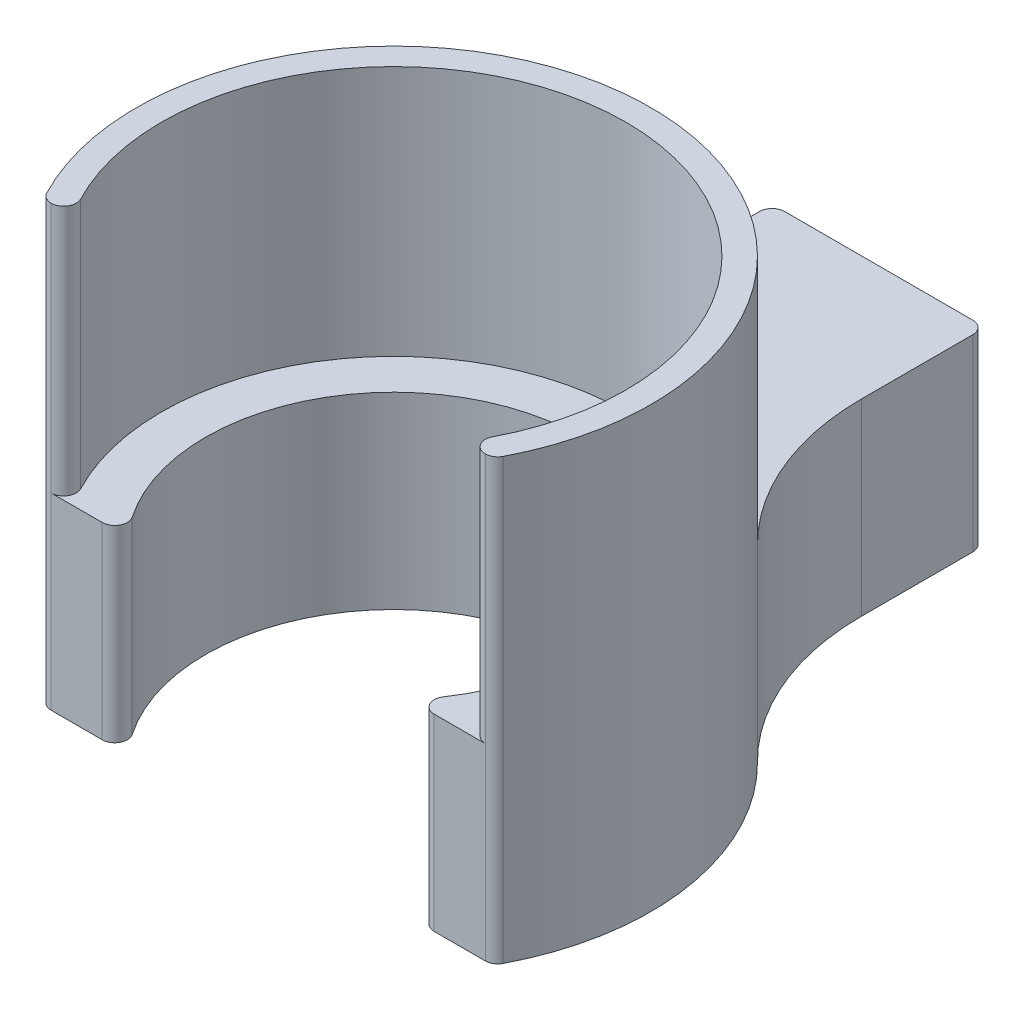
from build123d import *

# Parameters (mm, degrees)
ESQUISSE1_W                    = 17
ESQUISSE1_H                    = 15
BOSS_EXTRU_1_DEPTH             = 20
TROUS_DE_CENTRAGE_5_0MM1_D     = 5
TROUS_DE_CENTRAGE_5_0MM1_DEPTH = 10
TROUS_DE_CENTRAGE_5_0MM1_TIP   = 1.5021515475689007
BOSS_EXTRU_2_DEPTH             = 20
BOSS_EXTRU_3_START             = 15
BOSS_EXTRU_3_DEPTH             = 15
CONG_1_R                       = 19.999999999999996
CONG_2_R                       = 1


with BuildPart() as part:
    # Esquisse1 → Boss.-Extru.1 (new body)
    with BuildSketch(Plane.XY):
        Rectangle(ESQUISSE1_W, ESQUISSE1_H)
    extrude(amount=BOSS_EXTRU_1_DEPTH)

    # Trous de centrage Ø5.0mm1
    with Locations(Plane(origin=(0, 0, 0), x_dir=(-1, 0, 0), z_dir=(0, 0, -1))):
        with Locations((0, 0)):
            Hole(TROUS_DE_CENTRAGE_5_0MM1_D / 2, depth=TROUS_DE_CENTRAGE_5_0MM1_DEPTH)
            with Locations((0, 0, -(TROUS_DE_CENTRAGE_5_0MM1_DEPTH + TROUS_DE_CENTRAGE_5_0MM1_TIP / 2))):  # 118° drill point
                Cone(0, TROUS_DE_CENTRAGE_5_0MM1_D / 2, TROUS_DE_CENTRAGE_5_0MM1_TIP, mode=Mode.SUBTRACT)

    # Esquisse4 → Boss.-Extru.2 (add)
    with BuildSketch(Plane(origin=(0, 7.499999999999998, 0), x_dir=(1, 0, 0), z_dir=(0, 1, 0))):
        with BuildLine():
            Line((-17.89553016817328, -48.65475810617763), (-15.56438241627338, -48.65475810617763))
            ThreePointArc((-15.56438241627338, -48.65475810617763), (-6e-16, -20.15475810617762), (15.564382416273377, -48.65475810617763))
            Line((15.564382416273377, -48.65475810617763), (17.895530168173273, -48.65475810617763))
            ThreePointArc((17.895530168173273, -48.65475810617763), (-4.8e-16, -18.154758106177628), (-17.89553016817328, -48.65475810617763))
        make_face()
    extrude(amount=BOSS_EXTRU_2_DEPTH)

    # Esquisse5 → Boss.-Extru.3 (add)
    with BuildSketch(Plane.XZ.offset(-7.499999999999998).offset(BOSS_EXTRU_3_START)):
        with BuildLine():
            Line((-15.564382416273382, 48.65475810617763), (-11.180339887498954, 48.654758106177624))
            ThreePointArc((-11.180339887498954, 48.654758106177624), (-4.49e-15, 23.65475810617762), (11.180339887498954, 48.654758106177624))
            Line((11.180339887498954, 48.654758106177624), (15.564382416273377, 48.65475810617763))
            Line((15.564382416273377, 48.65475810617763), (17.895530168173273, 48.65475810617763))
            ThreePointArc((17.895530168173273, 48.65475810617763), (19.479599424670532, 32.26764559312642), (8.499999999999998, 20))
            Line((8.499999999999998, 20), (-8.49999999999999, 20))
            ThreePointArc((-8.49999999999999, 20), (-19.47959942467054, 32.26764559312641), (-17.89553016817328, 48.65475810617763))
            Line((-17.89553016817328, 48.65475810617763), (-15.564382416273382, 48.65475810617763))
        make_face()
    extrude(amount=-BOSS_EXTRU_3_DEPTH)

    # Congé1
    cong_1_edges = [part.edges().sort_by_distance(p)[0] for p in [
        (-8.500000000000002, -1.78e-15, 20),
        (8.499999999999998, -1.78e-15, 20),
    ]]
    fillet(cong_1_edges, radius=CONG_1_R)

    # Congé2
    cong_2_edges = [part.edges().sort_by_distance(p)[0] for p in [
        (-17.89553016817328, 9.999999999999998, 48.654758106177624),
        (17.895530168173273, 10, 48.65475810617764),
        (15.564382416273379, 17.5, 48.65475810617763),
        (-15.564382416273382, 17.5, 48.65475810617763),
        (11.180339887498956, -1.78e-15, 48.654758106177624),
        (-11.180339887498954, -1.78e-15, 48.654758106177624),
        (-8.500000000000002, -1.78e-15, 0),
        (8.499999999999998, -1.78e-15, 0),
    ]]
    fillet(cong_2_edges, radius=CONG_2_R - 0.0001)  # a hair under: the kernel refuses the full size


solid = part.part
